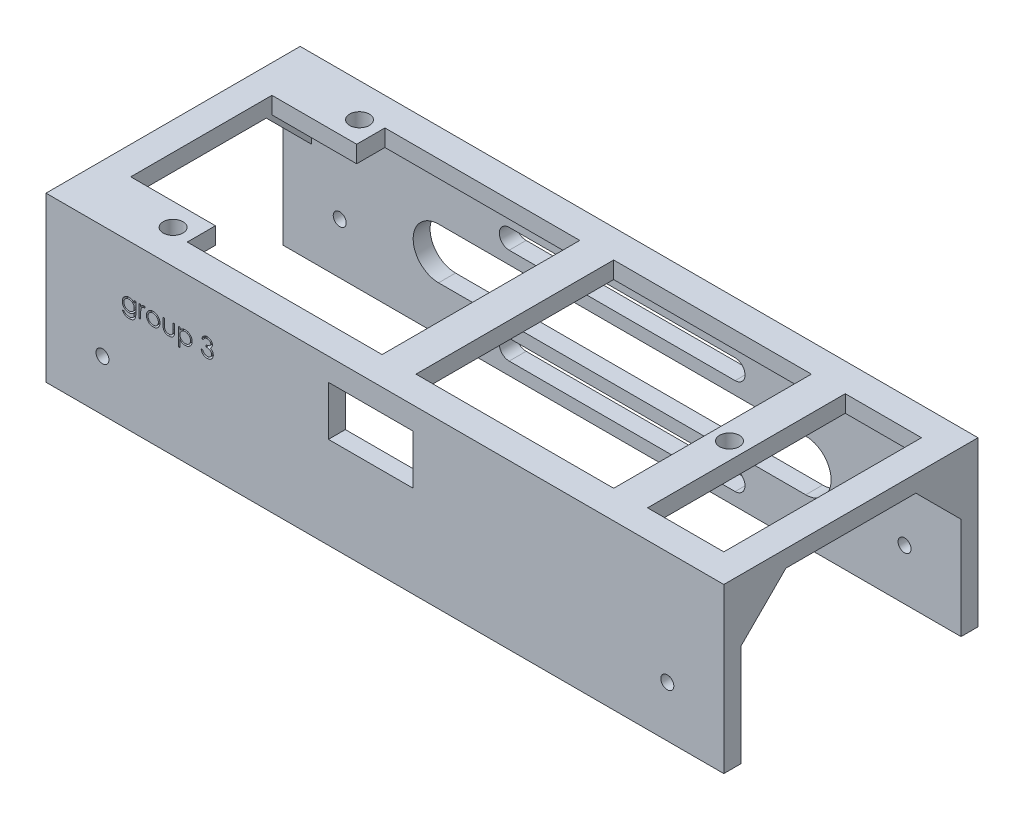
from build123d import *

# Parameters (mm, degrees)
SKETCH1_W           = 120
SKETCH1_H           = 29
BOSS_EXTRUDE5_DEPTH = 45
SHELL9_T            = -3
SKETCH3_R           = 1.15
CUT_EXTRUDE2_DEPTH  = 79
CUT_EXTRUDE8_DEPTH  = 23
SKETCH7_W           = 15
SKETCH7_H           = 8.75
CUT_EXTRUDE9_DEPTH  = 20
SKETCH13_W          = 110
SKETCH13_H          = 35
CUT_EXTRUDE14_DEPTH = 10
SKETCH17_W          = 15
SKETCH17_H          = 5
SKETCH17_W_2        = 6
SKETCH17_H_2        = 35
BOSS_EXTRUDE6_DEPTH = 3
SKETCH17_4_R        = 1.75
CUT_EXTRUDE16_DEPTH = 10
CUT_EXTRUDE15_DEPTH = 1.5
BOSS_EXTRUDE7_DEPTH = 5
BOSS_EXTRUDE8_DEPTH = 5


with BuildPart() as part:
    # Sketch1 → Boss-Extrude5 (new body)
    with BuildSketch(Plane.XY):
        with Locations((60, 14.5)):
            Rectangle(SKETCH1_W, SKETCH1_H)
    extrude(amount=BOSS_EXTRUDE5_DEPTH)

    # Shell9
    shell9_openings = [part.faces().sort_by_distance(p)[0] for p in [
        (120, 14.5, 22.5),
        (60, 0, 22.5),
        (0, 14.5, 22.5),
    ]]
    offset(amount=SHELL9_T, openings=shell9_openings, kind=Kind.INTERSECTION)

    # Sketch3 → Cut-Extrude2 (cut)
    with BuildSketch(Plane(origin=(0, 0, 0), x_dir=(-1, 0, 0), z_dir=(0, 0, -1))):
        with Locations((-10, 9)):
            Circle(SKETCH3_R)
        with Locations((-110, 9)):
            Circle(SKETCH3_R)
    extrude(amount=-CUT_EXTRUDE2_DEPTH, mode=Mode.SUBTRACT)

    # Sketch6 → Cut-Extrude8 (cut)
    with BuildSketch(Plane(origin=(0, 0, 0), x_dir=(-1, 0, 0), z_dir=(0, 0, -1))):
        with BuildLine():
            Line((-40, 22.75), (-80, 22.75))
            ThreePointArc((-80, 22.75), (-81.75, 21), (-80, 19.25))
            Line((-80, 19.25), (-40, 19.25))
            ThreePointArc((-40, 19.25), (-38.25, 21), (-40, 22.75))
        make_face()
        with BuildLine():
            Line((-27.5, 17), (-92.5, 17))
            ThreePointArc((-92.5, 17), (-97, 12.5), (-92.5, 8))
            Line((-92.5, 8), (-27.5, 8))
            ThreePointArc((-27.5, 8), (-23, 12.5), (-27.5, 17))
        make_face()
        with BuildLine():
            ThreePointArc((-80, 5.75), (-81.75, 4), (-80, 2.25))
            Line((-80, 2.25), (-40, 2.25))
            ThreePointArc((-40, 2.25), (-38.25, 4), (-40, 5.75))
            Line((-40, 5.75), (-80, 5.75))
        make_face()
    extrude(amount=-CUT_EXTRUDE8_DEPTH, mode=Mode.SUBTRACT)

    # Sketch7 → Cut-Extrude9 (cut)
    with BuildSketch(Plane.XY.offset(45)):
        with Locations((57.5, 20.625)):
            Rectangle(SKETCH7_W, SKETCH7_H)
    extrude(amount=-CUT_EXTRUDE9_DEPTH, mode=Mode.SUBTRACT)

    # Sketch13 → Cut-Extrude14 (cut)
    with BuildSketch(Plane(origin=(0, 29, 0), x_dir=(1, 0, 0), z_dir=(0, 1, 0))):
        with Locations((60, -22.5)):
            Rectangle(SKETCH13_W, SKETCH13_H)
    extrude(amount=-CUT_EXTRUDE14_DEPTH, mode=Mode.SUBTRACT)

    # Sketch17 → Boss-Extrude6 (add)
    with BuildSketch(Plane(origin=(0, 29, 0), x_dir=(1, 0, 0), z_dir=(0, 1, 0))):
        with Locations((12.5, -7.5)):
            Rectangle(SKETCH17_W, SKETCH17_H)
        with Locations((12.5, -37.5)):
            Rectangle(SKETCH17_W, SKETCH17_H)
        with Locations((57.5, -22.5)):
            Rectangle(SKETCH17_W_2, SKETCH17_H_2)
        with Locations((98.5, -22.5)):
            Rectangle(SKETCH17_W_2, SKETCH17_H_2)
    extrude(amount=-BOSS_EXTRUDE6_DEPTH)

    # Sketch17<4> → Cut-Extrude16 (cut)
    with BuildSketch(Plane(origin=(0, 29, 0), x_dir=(1, 0, 0), z_dir=(0, 1, 0))):
        with Locations((98.5, -22.5)):
            Circle(SKETCH17_4_R)
        with Locations((16.5, -6)):
            Circle(SKETCH17_4_R)
        with Locations((16.5, -39)):
            Circle(SKETCH17_4_R)
    extrude(amount=-CUT_EXTRUDE16_DEPTH, mode=Mode.SUBTRACT)

    # Sketch20 → Cut-Extrude15 (cut)
    # profile 1 of 6: a face of its own
    with BuildSketch(Plane.XY.offset(45)):
        with BuildLine():
            Line((15.616704574, 20.332761713), (15.901640472, 20.332761713))
            Line((15.901640472, 20.332761713), (15.901640472, 18.49149068))
            add(Edge.make_bspline(
                [(15.901640472, 18.49149068), (15.901389155, 18.452268005), (15.900904052, 18.376558794), (15.897410671, 18.267086354), (15.890044057, 18.165970691), (15.881690467, 18.072750642), (15.869673803, 17.9878583), (15.854999527, 17.91104035), (15.838457161, 17.842223075), (15.823924535, 17.799836969), (15.817050127, 17.779786954)],
                knots=[0, 0, 0, 0, 1.307562039, 2.523909702, 3.650326591, 4.686913197, 5.643429486, 6.506965704, 7.293745905, 8, 8, 8, 8], degree=3))
            add(Edge.make_bspline(
                [(15.817050127, 17.779786954), (15.806899889, 17.753724811), (15.786902899, 17.702379766), (15.749450931, 17.629595775), (15.707510176, 17.561064407), (15.659606909, 17.497167576), (15.605957751, 17.438226048), (15.547826683, 17.382959277), (15.484081581, 17.332536497), (15.414758892, 17.287827692), (15.341456639, 17.247562292), (15.264216961, 17.212685764), (15.183475406, 17.182308413), (15.098473497, 17.159554734), (15.010543928, 17.139838237), (14.918652687, 17.127006986), (14.823336649, 17.118273869), (14.758525483, 17.117466301), (14.725643877, 17.117056585)],
                knots=[0, 0, 0, 0, 0.981931301, 1.934503488, 2.87077864, 3.801706999, 4.735015492, 5.667491629, 6.616593066, 7.585388521, 8.561939025, 9.551802639, 10.560317337, 11.588439944, 12.640189604, 13.723962949, 14.845264515, 16, 16, 16, 16], degree=3))
            add(Edge.make_bspline(
                [(14.725643877, 17.117056585), (14.677669868, 17.11783354), (14.583963739, 17.119351142), (14.447343495, 17.137032186), (14.317590571, 17.162027939), (14.196419457, 17.19986072), (14.084595869, 17.246158561), (13.982883496, 17.299312554), (13.89219542, 17.360262855), (13.810440374, 17.429659829), (13.736651931, 17.512176883), (13.667230747, 17.609421549), (13.600409749, 17.722875084), (13.561249628, 17.806144188), (13.540743036, 17.849748893)],
                knots=[0, 0, 0, 0, 1.157897085, 2.2616841, 3.32207898, 4.345638746, 5.321241055, 6.241986252, 7.112515963, 7.955008012, 8.825025602, 9.77857164, 10.836726669, 12, 12, 12, 12], degree=3))
            Line((13.540743036, 17.849748893), (13.825678933, 17.849748893))
            add(Edge.make_bspline(
                [(13.825678933, 17.849748893), (13.848595366, 17.813367134), (13.89339417, 17.742245276), (13.977167435, 17.650158342), (14.068976031, 17.571460647), (14.171918315, 17.508041587), (14.286422618, 17.460226276), (14.412557826, 17.426140115), (14.55135034, 17.405732787), (14.647977577, 17.403273256), (14.698295119, 17.401992483)],
                knots=[0, 0, 0, 0, 0.997731894, 1.950442991, 2.880492273, 3.800895997, 4.748200782, 5.754801363, 6.83083817, 8, 8, 8, 8], degree=3))
            add(Edge.make_bspline(
                [(14.698295119, 17.401992483), (14.747976513, 17.403289832), (14.843757266, 17.405790991), (14.981489827, 17.426149222), (15.107215235, 17.460233694), (15.220209131, 17.507957016), (15.319138293, 17.566422742), (15.404420599, 17.631737095), (15.473494698, 17.705379862), (15.519952175, 17.773217644), (15.548830721, 17.833655247), (15.567220536, 17.885682245), (15.582164779, 17.944513069), (15.594665061, 18.009950487), (15.604980103, 18.08208799), (15.611514147, 18.161090521), (15.616236561, 18.246778529), (15.616544963, 18.306190162), (15.616704574, 18.336938396)],
                knots=[0, 0, 0, 0, 1.570740765, 3.028230971, 4.391408896, 5.680370741, 6.894727393, 8.017376726, 9.065722033, 10.075533815, 10.603371122, 11.180248986, 11.817768598, 12.521299649, 13.286540596, 14.121245857, 15.027658897, 16, 16, 16, 16], degree=3))
            Line((15.616704574, 18.336938396), (15.616704574, 18.457145728))
            add(Edge.make_bspline(
                [(15.616704574, 18.457145728), (15.587783846, 18.422727093), (15.530451097, 18.354495237), (15.431438879, 18.265085752), (15.323292106, 18.188081905), (15.206194892, 18.124927858), (15.083015558, 18.074416852), (14.955088249, 18.039090023), (14.823559742, 18.016266399), (14.734431006, 18.013810477), (14.689390872, 18.012569406)],
                knots=[0, 0, 0, 0, 1.012485704, 2.007162095, 2.997754123, 3.998611389, 4.999708251, 5.992315798, 6.98544096, 8, 8, 8, 8], degree=3))
            add(Edge.make_bspline(
                [(14.689390872, 18.012569406), (14.662869399, 18.013036608), (14.610140308, 18.013965485), (14.531804216, 18.022092376), (14.454624104, 18.033884092), (14.378779973, 18.051193683), (14.304162381, 18.073411178), (14.230894637, 18.101184934), (14.158383509, 18.132585791), (14.087947043, 18.169572548), (14.020286767, 18.210722641), (13.955913021, 18.255298635), (13.895162989, 18.303067225), (13.838614888, 18.354499449), (13.786342893, 18.409520868), (13.737643956, 18.467544948), (13.693323362, 18.52938192), (13.652471645, 18.593904232), (13.617040867, 18.661541641), (13.585940044, 18.730827485), (13.558898655, 18.801613615), (13.537340041, 18.874137022), (13.520874388, 18.948351984), (13.508618682, 19.02413692), (13.501667308, 19.1017252), (13.500583341, 19.153995995), (13.500037908, 19.180297771)],
                knots=[0, 0, 0, 0, 1.028754217, 2.045334182, 3.052854819, 4.056607503, 5.061168794, 6.071104265, 7.095078842, 8.125279047, 9.155117945, 10.165957491, 11.161587969, 12.151493252, 13.128948131, 14.104219989, 15.088194871, 16.07871515, 17.064853787, 18.047899887, 19.02414258, 20.002704429, 20.980574569, 21.971845993, 22.979467364, 24, 24, 24, 24], degree=3))
            add(Edge.make_bspline(
                [(13.500037908, 19.180297771), (13.500508866, 19.206607723), (13.501448958, 19.259125723), (13.509568775, 19.337030594), (13.521151346, 19.413892296), (13.53948268, 19.488918582), (13.561546682, 19.562963892), (13.588873066, 19.635481306), (13.621728655, 19.706492911), (13.658930356, 19.776051293), (13.700735212, 19.843223058), (13.746575391, 19.907019373), (13.796506234, 19.966970786), (13.8498389, 20.023682111), (13.907224591, 20.07660618), (13.96863362, 20.125614541), (14.033460661, 20.171528693), (14.101906631, 20.213358264), (14.172915405, 20.250353587), (14.24468294, 20.284110729), (14.31815991, 20.310902394), (14.391976428, 20.334509063), (14.467432493, 20.351232418), (14.543602915, 20.364134024), (14.620748464, 20.371994163), (14.672412876, 20.372975315), (14.698295119, 20.373466842)],
                knots=[0, 0, 0, 0, 1.008818848, 2.013730394, 3.001654427, 3.987803273, 4.973046549, 5.963777569, 6.957074694, 7.972068341, 8.987420212, 9.989399531, 10.982630087, 11.977756091, 12.973280677, 13.973972381, 14.989194003, 16.018387222, 17.047741039, 18.059210846, 19.057554164, 20.045176975, 21.029480261, 22.018708529, 23.007435371, 24, 24, 24, 24], degree=3))
            add(Edge.make_bspline(
                [(14.698295119, 20.373466842), (14.740977042, 20.372236145), (14.825260726, 20.369805898), (14.949295278, 20.350736716), (15.068985739, 20.320334718), (15.18500751, 20.276777682), (15.298305708, 20.217314433), (15.408506924, 20.138989044), (15.515929996, 20.04109895), (15.582222028, 19.966030281), (15.616704574, 19.926982467)],
                knots=[0, 0, 0, 0, 0.96728863, 1.910097829, 2.838038873, 3.762875196, 4.71315279, 5.730631239, 6.819562287, 8, 8, 8, 8], degree=3))
            Line((15.616704574, 19.926982467), (15.616704574, 20.332761713))
        make_face()
        with BuildLine():
            add(Edge.make_bspline(
                [(14.721191754, 20.088530944), (14.679526044, 20.087114835), (14.597036773, 20.084311238), (14.476125205, 20.060376534), (14.359396844, 20.022869897), (14.249083349, 19.969219095), (14.145753328, 19.903819322), (14.054064026, 19.824589204), (13.973868138, 19.734105154), (13.90602933, 19.633185287), (13.852025876, 19.524307938), (13.813795774, 19.409544629), (13.78907611, 19.290749742), (13.78634774, 19.209676024), (13.784973805, 19.168849454)],
                knots=[0, 0, 0, 0, 1.026226791, 2.031711442, 3.026614839, 4.04107745, 5.047145931, 6.032893242, 7.017642609, 8.019221815, 9.021877557, 10.003543541, 10.994637589, 12, 12, 12, 12], degree=3))
            add(Edge.make_bspline(
                [(13.784973805, 19.168849454), (13.78563217, 19.138067128), (13.786926982, 19.077527295), (13.799376227, 18.988683633), (13.819497532, 18.904065063), (13.848015569, 18.823666466), (13.883351228, 18.747026688), (13.927794307, 18.674673668), (13.980091974, 18.60654297), (14.039834895, 18.543138509), (14.105672041, 18.485388916), (14.177081601, 18.434645122), (14.25396672, 18.393142682), (14.334436469, 18.357273494), (14.42044337, 18.331076054), (14.510748612, 18.311083733), (14.605991079, 18.299645788), (14.670916871, 18.298228108), (14.704019278, 18.297505303)],
                knots=[0, 0, 0, 0, 1.039728707, 2.044842319, 3.024901384, 3.974314358, 4.923051295, 5.871625912, 6.837440708, 7.820715446, 8.810779094, 9.792721783, 10.773906224, 11.758876063, 12.764959493, 13.806266761, 14.881525401, 16, 16, 16, 16], degree=3))
            add(Edge.make_bspline(
                [(14.704019278, 18.297505303), (14.737550687, 18.298201634), (14.803121003, 18.299563302), (14.898888923, 18.311268619), (14.989632909, 18.330157126), (15.075269755, 18.356975013), (15.1561228, 18.39119403), (15.231283772, 18.434497961), (15.302364264, 18.483814268), (15.367094722, 18.541338023), (15.425627358, 18.604733697), (15.476636696, 18.673717281), (15.520101946, 18.747250752), (15.556095261, 18.825325821), (15.583573711, 18.908549241), (15.60200586, 18.996712964), (15.614893407, 19.089394606), (15.616091675, 19.152902422), (15.616704574, 19.185385912)],
                knots=[0, 0, 0, 0, 1.121943988, 2.193949579, 3.223793937, 4.220241907, 5.192961521, 6.155822191, 7.11847367, 8.083710714, 9.04790392, 10.001595906, 10.949595423, 11.902125208, 12.873731292, 13.87582262, 14.913508608, 16, 16, 16, 16], degree=3))
            add(Edge.make_bspline(
                [(15.616704574, 19.185385912), (15.615489395, 19.227674965), (15.613115361, 19.310292915), (15.59071151, 19.430676912), (15.554588891, 19.543859923), (15.503927909, 19.649483987), (15.440444229, 19.746429935), (15.363980388, 19.83290228), (15.27585506, 19.909012343), (15.176321441, 19.97241999), (15.069235544, 20.023642205), (14.957184173, 20.062070384), (14.840333683, 20.083836656), (14.761134297, 20.086957176), (14.721191754, 20.088530944)],
                knots=[0, 0, 0, 0, 1.070913519, 2.092188694, 3.091357305, 4.074328408, 5.051968682, 6.018948707, 6.99050112, 7.9935919, 9.000589572, 9.992915277, 10.987769056, 12, 12, 12, 12], degree=3))
        make_face(mode=Mode.SUBTRACT)
    # profile 2 of 6: a face of its own
    with BuildSketch(Plane.XY.offset(45)):
        with BuildLine():
            Line((16.471512267, 20.332761713), (16.756448164, 20.332761713))
            Line((16.756448164, 20.332761713), (16.756448164, 19.991220247))
            add(Edge.make_bspline(
                [(16.756448164, 19.991220247), (16.777483681, 20.023020891), (16.817713944, 20.083839376), (16.884582101, 20.1642751), (16.953074409, 20.230873035), (17.023518757, 20.283944084), (17.096433176, 20.323688842), (17.170217411, 20.352801809), (17.246032302, 20.370016945), (17.29697919, 20.372315336), (17.322503853, 20.373466842)],
                knots=[0, 0, 0, 0, 1.2804753, 2.448899062, 3.506932113, 4.484331642, 5.4025378, 6.288909075, 7.142734305, 8, 8, 8, 8], degree=3))
            add(Edge.make_bspline(
                [(17.322503853, 20.373466842), (17.342303449, 20.372386864), (17.383042405, 20.37016474), (17.444712326, 20.354552063), (17.508251743, 20.329625571), (17.549202337, 20.306184798), (17.570550728, 20.293964638)],
                knots=[0, 0, 0, 0, 0.901110191, 1.854092781, 2.881294221, 4, 4, 4, 4], degree=3))
            Line((17.570550728, 20.293964638), (17.414090392, 20.047189798))
            add(Edge.make_bspline(
                [(17.414090392, 20.047189798), (17.400384351, 20.053304183), (17.374367662, 20.064910455), (17.336308877, 20.078646421), (17.301219379, 20.08673443), (17.278864151, 20.087959724), (17.268442355, 20.088530944)],
                knots=[0, 0, 0, 0, 1.180555205, 2.24091978, 3.179933427, 4, 4, 4, 4], degree=3))
            add(Edge.make_bspline(
                [(17.268442355, 20.088530944), (17.245577154, 20.08700691), (17.198938771, 20.083898323), (17.130463547, 20.059460976), (17.064017868, 20.019977365), (17.01124786, 19.976188571), (16.970388102, 19.933963069), (16.941232326, 19.897089161), (16.914487262, 19.855742831), (16.888932848, 19.810630903), (16.865649853, 19.760983115), (16.843919546, 19.707295485), (16.824271863, 19.649505833), (16.813068427, 19.609244546), (16.807329574, 19.588621088)],
                knots=[0, 0, 0, 0, 1.125678352, 2.296057538, 3.5422874, 4.923748041, 5.663163013, 6.437101912, 7.23742474, 8.08941207, 8.991984279, 9.93940061, 10.944477711, 12, 12, 12, 12], degree=3))
            add(Edge.make_bspline(
                [(16.807329574, 19.588621088), (16.803036618, 19.570226795), (16.793528044, 19.529484834), (16.784282864, 19.461132958), (16.775148372, 19.380375782), (16.768710726, 19.286988515), (16.762743502, 19.18120437), (16.759377927, 19.06286219), (16.756562935, 18.931840507), (16.756487582, 18.840242344), (16.756448164, 18.792327018)],
                knots=[0, 0, 0, 0, 0.566838948, 1.255505196, 2.06880316, 3.007127437, 4.065329342, 5.249902469, 6.561414163, 8, 8, 8, 8], degree=3))
            Line((16.756448164, 18.792327018), (16.756448164, 18.012569406))
            Line((16.756448164, 18.012569406), (16.471512267, 18.012569406))
            Line((16.471512267, 18.012569406), (16.471512267, 20.332761713))
        make_face()
    # profile 3 of 6: a face of its own
    with BuildSketch(Plane.XY.offset(45)):
        with BuildLine():
            add(Edge.make_bspline(
                [(18.976149687, 20.373466842), (19.019684627, 20.37253984), (19.105046006, 20.370722218), (19.230057445, 20.351295784), (19.349387675, 20.321589247), (19.463493721, 20.280521473), (19.570914218, 20.225474275), (19.673213846, 20.159788703), (19.770112133, 20.081971636), (19.828190167, 20.021775389), (19.857670119, 19.991220247)],
                knots=[0, 0, 0, 0, 1.054011418, 2.066658804, 3.057071809, 4.030435133, 4.997543892, 5.974964718, 6.972108034, 8, 8, 8, 8], degree=3))
            add(Edge.make_bspline(
                [(19.857670119, 19.991220247), (19.883053749, 19.96199756), (19.933329765, 19.904117725), (19.997796525, 19.810268705), (20.053333226, 19.713077328), (20.09784034, 19.611252967), (20.132933183, 19.505684516), (20.157848493, 19.39600912), (20.172668427, 19.282468991), (20.174666833, 19.205358366), (20.175678933, 19.166305383)],
                knots=[0, 0, 0, 0, 1.025258237, 2.030674902, 3.01204498, 3.988269485, 4.97094183, 5.956517959, 6.965070386, 8, 8, 8, 8], degree=3))
            add(Edge.make_bspline(
                [(20.175678933, 19.166305383), (20.17478872, 19.127026045), (20.173029618, 19.049408242), (20.156389337, 18.935090674), (20.130507566, 18.824242513), (20.093467256, 18.717327841), (20.045970971, 18.614019848), (19.98801299, 18.514769757), (19.919186595, 18.41938175), (19.841168683, 18.328665797), (19.754943053, 18.245057873), (19.661401975, 18.172188657), (19.562383673, 18.109757703), (19.456571489, 18.059468955), (19.344931697, 18.019818012), (19.227223499, 17.991968712), (19.103629757, 17.975130613), (19.019240778, 17.972968371), (18.976149687, 17.971864278)],
                knots=[0, 0, 0, 0, 0.998656419, 1.973391657, 2.932242238, 3.890759089, 4.846373663, 5.82037756, 6.809684879, 7.83454468, 8.860553229, 9.859544525, 10.845671541, 11.83227036, 12.833544569, 13.85385346, 14.904124723, 16, 16, 16, 16], degree=3))
            add(Edge.make_bspline(
                [(18.976149687, 17.971864278), (18.932847477, 17.972972077), (18.848037911, 17.975141758), (18.724007913, 17.991903293), (18.606088759, 18.019805177), (18.494302816, 18.05959926), (18.388035705, 18.10975931), (18.288443668, 18.171999915), (18.194826602, 18.245079484), (18.10858273, 18.328659941), (18.03056971, 18.419383259), (17.961742052, 18.514769365), (17.903784399, 18.61401995), (17.856288029, 18.717327814), (17.819247741, 18.824242521), (17.793365964, 18.935090672), (17.776725685, 19.049408242), (17.774966583, 19.127026045), (17.774076369, 19.166305383)],
                knots=[0, 0, 0, 0, 1.099876186, 2.154163076, 3.173186993, 4.173200201, 5.163417411, 6.152872554, 7.150605724, 8.17532212, 9.198891216, 10.186952605, 11.159729845, 12.11414092, 13.071450619, 14.029093627, 15.002601286, 16, 16, 16, 16], degree=3))
            add(Edge.make_bspline(
                [(17.774076369, 19.166305383), (17.775095372, 19.205146107), (17.777112823, 19.282044065), (17.791917856, 19.395370756), (17.816735975, 19.50486053), (17.851870885, 19.610021498), (17.896788237, 19.711399643), (17.951544548, 19.808831168), (18.016668907, 19.902255816), (18.066744963, 19.960060846), (18.092085183, 19.989312194)],
                knots=[0, 0, 0, 0, 1.031353054, 2.041901799, 3.029428768, 4.008703097, 4.981709435, 5.96992636, 6.972712378, 8, 8, 8, 8], degree=3))
            add(Edge.make_bspline(
                [(18.092085183, 19.989312194), (18.121520691, 20.020132318), (18.179410796, 20.080745514), (18.276791428, 20.158335732), (18.378839394, 20.22538817), (18.487447005, 20.279341594), (18.601459312, 20.321830821), (18.721401054, 20.351372396), (18.8468367, 20.370652225), (18.932615785, 20.372519286), (18.976149687, 20.373466842)],
                knots=[0, 0, 0, 0, 1.027980169, 2.021703884, 2.998553061, 3.971491411, 4.943284454, 5.930300938, 6.949603206, 8, 8, 8, 8], degree=3))
        make_face()
        with BuildLine():
            add(Edge.make_bspline(
                [(18.974877651, 20.088530944), (18.94409139, 20.087655922), (18.883313609, 20.085928465), (18.793851557, 20.072789495), (18.707727274, 20.05197283), (18.624777366, 20.022396294), (18.545281559, 19.984206578), (18.469163744, 19.937299709), (18.396200031, 19.882296955), (18.327817731, 19.819284389), (18.26505949, 19.750451301), (18.210197326, 19.67711029), (18.163547408, 19.600450961), (18.124685264, 19.520393598), (18.095740886, 19.436126908), (18.074719644, 19.348605193), (18.061593069, 19.257650137), (18.059881854, 19.195818356), (18.059012267, 19.16439733)],
                knots=[0, 0, 0, 0, 1.021534396, 2.016698045, 2.994645724, 3.958388632, 4.93408049, 5.916473867, 6.921342795, 7.962252576, 8.998418191, 10.008913653, 10.997312074, 11.973003931, 12.956656626, 13.948281152, 14.957379055, 16, 16, 16, 16], degree=3))
            add(Edge.make_bspline(
                [(18.059012267, 19.16439733), (18.060469885, 19.123800849), (18.063362986, 19.043224424), (18.08688995, 18.924560048), (18.126247504, 18.810639368), (18.179394536, 18.702130218), (18.245984463, 18.601734651), (18.324440588, 18.512225519), (18.413920888, 18.434949819), (18.513358713, 18.370832194), (18.620722987, 18.319887273), (18.734348364, 18.283783917), (18.852858136, 18.260314596), (18.933848514, 18.257981901), (18.974877651, 18.256800175)],
                knots=[0, 0, 0, 0, 1.016792936, 2.018143844, 3.017858371, 4.030088057, 5.03801393, 6.028138512, 7.003788237, 7.991172063, 8.984598303, 9.972568034, 10.972917682, 12, 12, 12, 12], degree=3))
            add(Edge.make_bspline(
                [(18.974877651, 18.256800175), (19.015904429, 18.257988786), (19.096890148, 18.260335072), (19.215235258, 18.283665716), (19.328550076, 18.320045465), (19.435802834, 18.370774898), (19.535195396, 18.435193303), (19.625319242, 18.51178916), (19.703105482, 18.601971725), (19.769629538, 18.702263197), (19.82364694, 18.810471145), (19.862820273, 18.924581074), (19.886403798, 19.043219069), (19.889289264, 19.123799055), (19.890743036, 19.16439733)],
                knots=[0, 0, 0, 0, 1.02726834, 2.027799167, 3.010890988, 4.004497153, 4.992059811, 5.971914811, 6.958719428, 7.966827853, 8.981595046, 9.981490638, 10.983022906, 12, 12, 12, 12], degree=3))
            add(Edge.make_bspline(
                [(19.890743036, 19.16439733), (19.889873748, 19.195818544), (19.888163122, 19.257650694), (19.875032262, 19.348603063), (19.854026879, 19.436134725), (19.825024055, 19.520364757), (19.786330771, 19.600658243), (19.738781252, 19.67688521), (19.684143107, 19.750705362), (19.620627576, 19.819061879), (19.552316655, 19.882321519), (19.47932337, 19.937321037), (19.403318425, 19.984000427), (19.324053568, 20.022722945), (19.241093025, 20.051703747), (19.155089415, 20.072909691), (19.066009066, 20.085872941), (19.005449077, 20.087639276), (18.974877651, 20.088530944)],
                knots=[0, 0, 0, 0, 1.042956736, 2.052379634, 3.044323526, 4.02829302, 5.004299113, 5.996692471, 7.007513377, 8.048758398, 9.090003419, 10.095195979, 11.07790575, 12.047570684, 13.018257071, 13.989683339, 14.985167495, 16, 16, 16, 16], degree=3))
        make_face(mode=Mode.SUBTRACT)
    # profile 4 of 6: a face of its own
    with BuildSketch(Plane.XY.offset(45)):
        with BuildLine():
            Line((20.7048456, 20.332761713), (20.989781497, 20.332761713))
            Line((20.989781497, 20.332761713), (20.989781497, 19.256619887))
            add(Edge.make_bspline(
                [(20.989781497, 19.256619887), (20.989910225, 19.225030678), (20.990156476, 19.164602003), (20.991826473, 19.077647655), (20.995754486, 18.998348208), (21.000665598, 18.926657854), (21.00698125, 18.86258872), (21.014495442, 18.806364589), (21.022894153, 18.757347865), (21.031115329, 18.727826393), (21.034938749, 18.71409685)],
                knots=[0, 0, 0, 0, 1.388932606, 2.656963016, 3.823490214, 4.879454478, 5.816252168, 6.653371382, 7.373723809, 8, 8, 8, 8], degree=3))
            add(Edge.make_bspline(
                [(21.034938749, 18.71409685), (21.041072355, 18.696840388), (21.05321205, 18.662686223), (21.075231567, 18.613347625), (21.102471558, 18.567650048), (21.132280116, 18.523831353), (21.166660293, 18.483189551), (21.205177099, 18.445793272), (21.246541214, 18.410229561), (21.3080047, 18.368151928), (21.392059891, 18.323053022), (21.502416319, 18.284140387), (21.622072295, 18.260885035), (21.704771719, 18.258186961), (21.747278493, 18.256800175)],
                knots=[0, 0, 0, 0, 0.725840625, 1.436591201, 2.137033971, 2.831655856, 3.53531722, 4.242432219, 4.957935707, 5.694543706, 7.190802206, 8.724350549, 10.316345118, 12, 12, 12, 12], degree=3))
            add(Edge.make_bspline(
                [(21.747278493, 18.256800175), (21.789781318, 18.258216451), (21.872016419, 18.260956682), (21.990357713, 18.283438892), (22.098535782, 18.320999767), (22.195464859, 18.373439347), (22.2807053, 18.437612504), (22.351738594, 18.512913352), (22.410346603, 18.596959582), (22.435936578, 18.659665178), (22.448805937, 18.691200215)],
                knots=[0, 0, 0, 0, 1.157059328, 2.238695713, 3.266970494, 4.264342957, 5.228770407, 6.160125903, 7.074715775, 8, 8, 8, 8], degree=3))
            add(Edge.make_bspline(
                [(22.448805937, 18.691200215), (22.452610702, 18.703869643), (22.46102211, 18.731878654), (22.470059386, 18.779394569), (22.478200505, 18.836058889), (22.485152101, 18.902242407), (22.490109784, 18.977772166), (22.492782251, 19.062624564), (22.495801472, 19.156533227), (22.495847297, 19.222271837), (22.495871241, 19.256619887)],
                knots=[0, 0, 0, 0, 0.557542046, 1.232589297, 2.036731608, 2.971723315, 4.038036528, 5.22795436, 6.551621927, 8, 8, 8, 8], degree=3))
            Line((22.495871241, 19.256619887), (22.495871241, 20.332761713))
            Line((22.495871241, 20.332761713), (22.780807138, 20.332761713))
            Line((22.780807138, 20.332761713), (22.780807138, 19.203194406))
            add(Edge.make_bspline(
                [(22.780807138, 19.203194406), (22.780406458, 19.164815757), (22.779629084, 19.09035593), (22.774633136, 18.9821482), (22.766060988, 18.881308163), (22.753050123, 18.787782443), (22.737750547, 18.701642441), (22.7180145, 18.622777758), (22.694448527, 18.551431377), (22.667864238, 18.486351337), (22.636457258, 18.427344511), (22.60304989, 18.371341306), (22.564473847, 18.319731286), (22.523860848, 18.269945348), (22.478683632, 18.224459819), (22.42978876, 18.18223098), (22.377864429, 18.142613302), (22.321758371, 18.107151927), (22.262289657, 18.075205398), (22.199384872, 18.046887956), (22.132273538, 18.02447919), (22.061821525, 18.005147372), (21.98768366, 17.98998496), (21.909931418, 17.97929286), (21.828590988, 17.972738453), (21.773155978, 17.972160562), (21.744734422, 17.971864278)],
                knots=[0, 0, 0, 0, 1.493040784, 2.896703357, 4.213163133, 5.428574705, 6.569057535, 7.615249723, 8.588095153, 9.490268104, 10.346124644, 11.18633936, 12.024365274, 12.850166724, 13.684164916, 14.514361689, 15.362232829, 16.222528818, 17.093394965, 17.986930858, 18.902426812, 19.842810585, 20.827885679, 21.843828298, 22.894529745, 24, 24, 24, 24], degree=3))
            add(Edge.make_bspline(
                [(21.744734422, 17.971864278), (21.716525441, 17.97217244), (21.661092168, 17.972778009), (21.57974754, 17.979256649), (21.501779875, 17.989968347), (21.427466371, 18.005258437), (21.356732454, 18.024343879), (21.289291607, 18.047025657), (21.225933518, 18.075220094), (21.165896986, 18.106949736), (21.109651962, 18.142841093), (21.056939181, 18.1821821), (21.007829322, 18.224914029), (20.962311553, 18.270858417), (20.921024781, 18.320585209), (20.883454515, 18.373694396), (20.849022361, 18.429659748), (20.817859472, 18.489588474), (20.791088094, 18.555421654), (20.767452264, 18.628262592), (20.748120471, 18.708909875), (20.732388374, 18.797294553), (20.719732425, 18.892993627), (20.71094571, 18.996560689), (20.706032778, 19.107743467), (20.705249858, 19.18453301), (20.7048456, 19.224182988)],
                knots=[0, 0, 0, 0, 1.083640291, 2.129454052, 3.13281866, 4.105697902, 5.042300162, 5.946461698, 6.836384745, 7.703652036, 8.553297018, 9.397182691, 10.228592656, 11.052265423, 11.879314572, 12.708807002, 13.549817954, 14.402308542, 15.300838682, 16.27712199, 17.341985831, 18.484375296, 19.725102775, 21.0496083, 22.476576903, 24, 24, 24, 24], degree=3))
            Line((20.7048456, 19.224182988), (20.7048456, 20.332761713))
        make_face()
    # profile 5 of 6: a face of its own
    with BuildSketch(Plane.XY.offset(45)):
        with BuildLine():
            Line((23.43208919, 20.332761713), (23.717025087, 20.332761713))
            Line((23.717025087, 20.332761713), (23.717025087, 19.903449814))
            add(Edge.make_bspline(
                [(23.717025087, 19.903449814), (23.747285091, 19.942400473), (23.806089351, 20.018093283), (23.907439801, 20.116055757), (24.014416263, 20.198674068), (24.129771645, 20.263428223), (24.251713135, 20.312251388), (24.379740309, 20.348337032), (24.51493976, 20.369601798), (24.607374399, 20.372161448), (24.654515071, 20.373466842)],
                knots=[0, 0, 0, 0, 1.0828784, 2.104357462, 3.088488658, 4.04616522, 5.001424249, 5.969181776, 6.964304535, 8, 8, 8, 8], degree=3))
            add(Edge.make_bspline(
                [(24.654515071, 20.373466842), (24.69569174, 20.372275601), (24.777079588, 20.369921051), (24.896879803, 20.35397978), (25.012246044, 20.32665873), (25.122525636, 20.2872879), (25.228899988, 20.238614724), (25.329794321, 20.177185698), (25.42678019, 20.106060082), (25.517418447, 20.024206631), (25.601167116, 19.935643847), (25.673599009, 19.840373614), (25.736075665, 19.741528982), (25.786576577, 19.637577584), (25.826135578, 19.529337997), (25.854270321, 19.416372911), (25.87101404, 19.299101165), (25.873260536, 19.21936084), (25.874396882, 19.179025736)],
                knots=[0, 0, 0, 0, 1.041296284, 2.058176809, 3.050446431, 4.034000596, 5.01514041, 6.003636468, 7.015969324, 8.052561599, 9.08815499, 10.094063707, 11.074456064, 12.040834395, 13.011057502, 13.983766392, 14.980127149, 16, 16, 16, 16], degree=3))
            add(Edge.make_bspline(
                [(25.874396882, 19.179025736), (25.873285192, 19.137839356), (25.871092778, 19.056613871), (25.854088379, 18.93733629), (25.826913215, 18.822594172), (25.787853292, 18.712578369), (25.737378513, 18.607364628), (25.675960805, 18.507028826), (25.603492367, 18.41160311), (25.520669201, 18.322382979), (25.430814037, 18.240196459), (25.334768029, 18.16831621), (25.234021718, 18.107953677), (25.129090538, 18.057531992), (25.019076209, 18.019529797), (24.904492021, 17.992117935), (24.785400359, 17.975213785), (24.704391457, 17.972989342), (24.663419318, 17.971864278)],
                knots=[0, 0, 0, 0, 1.038740735, 2.04854663, 3.033179607, 4.009277356, 4.987731542, 5.972001279, 6.972200261, 8.005528982, 9.039189865, 10.040446548, 11.026516639, 11.997840187, 12.972163198, 13.956796175, 14.96660207, 16, 16, 16, 16], degree=3))
            add(Edge.make_bspline(
                [(24.663419318, 17.971864278), (24.617311449, 17.973038853), (24.52623489, 17.975358984), (24.393068432, 17.998871592), (24.264910145, 18.034011526), (24.143179897, 18.085445614), (24.026913381, 18.150991689), (23.916768272, 18.230920233), (23.812159503, 18.325064085), (23.749195845, 18.39648509), (23.717025087, 18.432977058)],
                knots=[0, 0, 0, 0, 1.014726462, 2.004382257, 2.969841629, 3.936926163, 4.907207904, 5.903978561, 6.929055279, 8, 8, 8, 8], degree=3))
            Line((23.717025087, 18.432977058), (23.717025087, 17.157761713))
            Line((23.717025087, 17.157761713), (23.43208919, 17.157761713))
            Line((23.43208919, 17.157761713), (23.43208919, 20.332761713))
        make_face()
        with BuildLine():
            add(Edge.make_bspline(
                [(24.651971001, 20.088530944), (24.619695255, 20.087950139), (24.55615263, 20.086806682), (24.46301426, 20.073223171), (24.373301979, 20.053503935), (24.287919923, 20.023648139), (24.206049721, 19.987000645), (24.128321943, 19.941206249), (24.05479115, 19.887093358), (23.985642343, 19.825698524), (23.923173499, 19.758048629), (23.867871414, 19.685851116), (23.821419073, 19.609197418), (23.782863669, 19.528801553), (23.753523691, 19.44403333), (23.732699574, 19.355375526), (23.719609182, 19.262731101), (23.717895646, 19.199633867), (23.717025087, 19.167577419)],
                knots=[0, 0, 0, 0, 1.05670511, 2.080379991, 3.077984906, 4.06214886, 5.038337365, 6.01289324, 7.01187578, 8.025460281, 9.038092164, 10.024533457, 11.000252242, 11.969694649, 12.940728589, 13.933144304, 14.949937299, 16, 16, 16, 16], degree=3))
            add(Edge.make_bspline(
                [(23.717025087, 19.167577419), (23.718468221, 19.125496774), (23.721295442, 19.043057226), (23.744280055, 18.922603059), (23.78168633, 18.808619057), (23.834780234, 18.702065116), (23.901861248, 18.604109258), (23.982686004, 18.516397065), (24.076523176, 18.439479886), (24.181812699, 18.374690606), (24.294681347, 18.322087146), (24.41241571, 18.284427827), (24.533396709, 18.261230162), (24.615192256, 18.258284834), (24.656423124, 18.256800175)],
                knots=[0, 0, 0, 0, 1.03728447, 2.032128127, 3.01272805, 3.987917167, 4.958271349, 5.931593992, 6.91984656, 7.941419022, 8.973179163, 9.983609215, 10.983593296, 12, 12, 12, 12], degree=3))
            add(Edge.make_bspline(
                [(24.656423124, 18.256800175), (24.696823428, 18.258212031), (24.777010768, 18.261014312), (24.895082778, 18.285269668), (25.009827857, 18.32232194), (25.118848442, 18.376350966), (25.221195463, 18.442563376), (25.313616587, 18.521992835), (25.394358573, 18.614058712), (25.463178381, 18.716573568), (25.518633371, 18.826496952), (25.56029866, 18.940235783), (25.584345723, 19.057389131), (25.587753667, 19.136308485), (25.589460985, 19.175845648)],
                knots=[0, 0, 0, 0, 1.00104056, 1.986885549, 2.97790532, 3.984399681, 4.995088187, 5.994304198, 6.996462723, 8.023150851, 9.048424203, 10.043036403, 11.019596776, 12, 12, 12, 12], degree=3))
            add(Edge.make_bspline(
                [(25.589460985, 19.175845648), (25.588141333, 19.215628388), (25.585512312, 19.294883921), (25.55961607, 19.411690268), (25.520699662, 19.525888647), (25.463949665, 19.63431086), (25.396638513, 19.736613063), (25.315225166, 19.826922653), (25.223951902, 19.905998906), (25.121726732, 19.971327171), (25.012016489, 20.023293299), (24.896523672, 20.061287742), (24.775834119, 20.08412393), (24.693621889, 20.087049017), (24.651971001, 20.088530944)],
                knots=[0, 0, 0, 0, 0.983928682, 1.960191568, 2.949917689, 3.96440592, 4.982380491, 5.975291189, 6.965713506, 7.964880129, 8.970154049, 9.96478489, 10.968906225, 12, 12, 12, 12], degree=3))
        make_face(mode=Mode.SUBTRACT)
    # profile 6 of 6: a face of its own
    with BuildSketch(Plane.XY.offset(45)):
        with BuildLine():
            Line((27.868948164, 20.454877098), (27.584012267, 20.454877098))
            add(Edge.make_bspline(
                [(27.584012267, 20.454877098), (27.591731645, 20.486837994), (27.606822398, 20.549318932), (27.638298054, 20.638588376), (27.672587378, 20.723064713), (27.71376178, 20.801166151), (27.758673293, 20.874462299), (27.810128904, 20.941290719), (27.865754653, 21.003351052), (27.927281571, 21.058426632), (27.991805428, 21.108299286), (28.060235405, 21.150821659), (28.131194744, 21.187401427), (28.205175086, 21.217536923), (28.282396685, 21.240238648), (28.362161414, 21.256709464), (28.444678304, 21.267405689), (28.50069219, 21.268449596), (28.529134462, 21.268979662)],
                knots=[0, 0, 0, 0, 1.162005537, 2.271625781, 3.343758855, 4.383309926, 5.390229558, 6.379919256, 7.361854164, 8.333198761, 9.295911338, 10.242430842, 11.177959212, 12.116337295, 13.062827104, 14.020064771, 14.994644689, 16, 16, 16, 16], degree=3))
            add(Edge.make_bspline(
                [(28.529134462, 21.268979662), (28.570575235, 21.267728503), (28.652552838, 21.265253477), (28.772987888, 21.242652524), (28.889126502, 21.206888297), (28.999697463, 21.157472844), (29.102402755, 21.096524353), (29.193784868, 21.023984913), (29.27260516, 20.941254118), (29.338730774, 20.849875292), (29.390505951, 20.752216366), (29.428684304, 20.651704794), (29.451926829, 20.548579006), (29.454939049, 20.478949189), (29.456448164, 20.444064798)],
                knots=[0, 0, 0, 0, 1.083050992, 2.142477498, 3.193116406, 4.255571735, 5.30263384, 6.308962982, 7.297363603, 8.282367274, 9.249857812, 10.179914175, 11.08814088, 12, 12, 12, 12], degree=3))
            add(Edge.make_bspline(
                [(29.456448164, 20.444064798), (29.455392621, 20.410494349), (29.453327086, 20.344802189), (29.435788653, 20.248897688), (29.406273615, 20.158508522), (29.365388902, 20.073254182), (29.312464781, 19.99367522), (29.248354549, 19.919592591), (29.172605706, 19.850677711), (29.115202669, 19.811199332), (29.085649887, 19.790874694)],
                knots=[0, 0, 0, 0, 1.024540389, 2.004866551, 2.965041327, 3.920577974, 4.882998113, 5.874504559, 6.905732034, 8, 8, 8, 8], degree=3))
            add(Edge.make_bspline(
                [(29.085649887, 19.790874694), (29.119424407, 19.774565924), (29.1863415, 19.742253534), (29.277555195, 19.678884383), (29.360357267, 19.605717553), (29.406534213, 19.548619575), (29.429735424, 19.519931185)],
                knots=[0, 0, 0, 0, 1.015518401, 2.012035669, 3.001164323, 4, 4, 4, 4], degree=3))
            add(Edge.make_bspline(
                [(29.429735424, 19.519931185), (29.445012927, 19.49901451), (29.475317754, 19.457523686), (29.512724274, 19.390815642), (29.546659685, 19.32336822), (29.573103098, 19.253373616), (29.59358082, 19.181643096), (29.608218507, 19.108053494), (29.617311835, 19.032544717), (29.618614085, 18.981461252), (29.619268677, 18.955783548)],
                knots=[0, 0, 0, 0, 1.025084078, 2.033381695, 3.024893161, 4.013698104, 4.991890475, 5.976764909, 6.982997093, 8, 8, 8, 8], degree=3))
            add(Edge.make_bspline(
                [(29.619268677, 18.955783548), (29.617640797, 18.91132473), (29.614392697, 18.822616317), (29.58536043, 18.691557105), (29.540354133, 18.563445399), (29.476439627, 18.440913224), (29.39854553, 18.326268164), (29.305874243, 18.223691798), (29.199478715, 18.135518778), (29.080819305, 18.0618495), (28.952261624, 18.00295967), (28.814760909, 17.962086133), (28.67029836, 17.935465119), (28.57123174, 17.932610459), (28.520866233, 17.931159149)],
                knots=[0, 0, 0, 0, 0.955779014, 1.907060117, 2.875433937, 3.871313158, 4.872415639, 5.851225146, 6.836215519, 7.83643374, 8.849228613, 9.86973379, 10.916971861, 12, 12, 12, 12], degree=3))
            add(Edge.make_bspline(
                [(28.520866233, 17.931159149), (28.486921582, 17.931946743), (28.420129828, 17.933496464), (28.321937512, 17.944090624), (28.22820997, 17.963439986), (28.138820478, 17.989477984), (28.053689623, 18.022490493), (27.973077185, 18.063601026), (27.89648721, 18.111962174), (27.824642448, 18.168144786), (27.757551461, 18.230992859), (27.696997204, 18.301622104), (27.641970106, 18.378726891), (27.59394357, 18.463202807), (27.550730048, 18.553958147), (27.515187323, 18.652154999), (27.483903986, 18.756915505), (27.469359344, 18.829920312), (27.461896882, 18.867377098)],
                knots=[0, 0, 0, 0, 1.048658725, 2.063410685, 3.046034179, 4.001477787, 4.936774919, 5.862367409, 6.792675028, 7.730719943, 8.675894397, 9.627829632, 10.600096036, 11.597688215, 12.626045268, 13.701542398, 14.82072376, 16, 16, 16, 16], degree=3))
            Line((27.461896882, 18.867377098), (27.74683278, 18.867377098))
            add(Edge.make_bspline(
                [(27.74683278, 18.867377098), (27.754256194, 18.842930493), (27.76869538, 18.795379723), (27.793273779, 18.726944589), (27.821275711, 18.664208355), (27.851315346, 18.606710808), (27.882864365, 18.5538857), (27.918165762, 18.507129862), (27.954604915, 18.464389643), (27.982072614, 18.440309888), (27.995515672, 18.428524935)],
                knots=[0, 0, 0, 0, 1.198163088, 2.33053128, 3.407730985, 4.417276592, 5.372219308, 6.28897303, 7.162600585, 8, 8, 8, 8], degree=3))
            add(Edge.make_bspline(
                [(27.995515672, 18.428524935), (28.013292567, 18.414819517), (28.048791482, 18.387450989), (28.106638378, 18.352524511), (28.16747581, 18.322261295), (28.232621979, 18.299143943), (28.300671092, 18.279569922), (28.372723059, 18.266760594), (28.448142206, 18.257972039), (28.499638677, 18.257196494), (28.525954374, 18.256800175)],
                knots=[0, 0, 0, 0, 0.946170439, 1.889420265, 2.845303464, 3.807233317, 4.801018734, 5.828864929, 6.890507805, 8, 8, 8, 8], degree=3))
            add(Edge.make_bspline(
                [(28.525954374, 18.256800175), (28.55566648, 18.257358889), (28.613765938, 18.258451406), (28.698542846, 18.268498654), (28.779194602, 18.283131244), (28.854825757, 18.305730878), (28.926427002, 18.333653508), (28.992994642, 18.368713133), (29.055402538, 18.409847273), (29.112851356, 18.456600653), (29.164509066, 18.507783009), (29.209992768, 18.561316295), (29.248659425, 18.616974797), (29.279850242, 18.675066521), (29.30447967, 18.735350908), (29.321246573, 18.797997131), (29.332904733, 18.862492508), (29.33385416, 18.906333787), (29.33433278, 18.92843479)],
                knots=[0, 0, 0, 0, 1.217147791, 2.380027433, 3.494444702, 4.572153297, 5.609568379, 6.639424714, 7.649109417, 8.668170816, 9.669597737, 10.625200337, 11.543417969, 12.441394052, 13.322311151, 14.205496177, 15.095365482, 16, 16, 16, 16], degree=3))
            add(Edge.make_bspline(
                [(29.33433278, 18.92843479), (29.332944577, 18.958017934), (29.330175081, 19.017037018), (29.309030869, 19.103866532), (29.274252043, 19.187526342), (29.225563407, 19.266589094), (29.166294568, 19.339864376), (29.097020688, 19.405243507), (29.017166509, 19.459191375), (28.943669914, 19.496464656), (28.878568665, 19.521898289), (28.822856137, 19.538839149), (28.760484076, 19.553184394), (28.692206745, 19.566530526), (28.617509684, 19.577889178), (28.536474216, 19.587361396), (28.449083918, 19.594940612), (28.388585503, 19.598325249), (28.357409703, 19.600069406)],
                knots=[0, 0, 0, 0, 1.07054697, 2.135767047, 3.216561865, 4.33974944, 5.486079747, 6.621378074, 7.775625952, 8.963672916, 9.598146892, 10.304877434, 11.070270905, 11.915000392, 12.823868403, 13.805723172, 14.86925407, 16, 16, 16, 16], degree=3))
            Line((28.357409703, 19.600069406), (28.357409703, 19.925710431))
            add(Edge.make_bspline(
                [(28.357409703, 19.925710431), (28.396690046, 19.926377003), (28.473630589, 19.927682654), (28.586020422, 19.943474206), (28.693492641, 19.965318776), (28.793665471, 19.998778915), (28.884968233, 20.037641184), (28.964179586, 20.08286426), (29.030189784, 20.133133354), (29.082678042, 20.189224364), (29.122165271, 20.249381585), (29.151036723, 20.312080268), (29.168091304, 20.377869952), (29.170367931, 20.422768686), (29.171512267, 20.445336834)],
                knots=[0, 0, 0, 0, 1.321986639, 2.589447074, 3.816329219, 5.01088745, 6.139805852, 7.153945165, 8.075214402, 8.924034688, 9.728124013, 10.488707548, 11.240355623, 12, 12, 12, 12], degree=3))
            add(Edge.make_bspline(
                [(29.171512267, 20.445336834), (29.171136337, 20.46191736), (29.170388442, 20.49490353), (29.160956626, 20.543095556), (29.146783388, 20.589814271), (29.127298205, 20.634860999), (29.101217668, 20.677923319), (29.070006523, 20.719368362), (29.032842604, 20.758959505), (28.990256377, 20.795862366), (28.944525668, 20.831031602), (28.894406229, 20.860888973), (28.841409243, 20.886420565), (28.785476034, 20.907474899), (28.726425089, 20.923312968), (28.664533855, 20.934684767), (28.599684313, 20.941794639), (28.555441385, 20.942818274), (28.532950568, 20.943338637)],
                knots=[0, 0, 0, 0, 0.884392785, 1.759457502, 2.611959086, 3.489218968, 4.37281399, 5.2945488, 6.255912374, 7.266815255, 8.301784654, 9.332968512, 10.37626691, 11.440494194, 12.520033166, 13.637162961, 14.798855837, 16, 16, 16, 16], degree=3))
            add(Edge.make_bspline(
                [(28.532950568, 20.943338637), (28.496799412, 20.942076472), (28.426187796, 20.939611172), (28.324392836, 20.918018439), (28.229760297, 20.883566892), (28.157425935, 20.842443367), (28.104011029, 20.80184833), (28.065841235, 20.766395023), (28.028357629, 20.726995247), (27.994026194, 20.681222292), (27.959306229, 20.63217599), (27.927697234, 20.577363079), (27.896981656, 20.518213378), (27.878473629, 20.476398052), (27.868948164, 20.454877098)],
                knots=[0, 0, 0, 0, 1.472543308, 2.876219568, 4.221790263, 5.565193594, 6.249813518, 6.953379497, 7.687249741, 8.463570142, 9.283606569, 10.136032583, 11.040678096, 12, 12, 12, 12], degree=3))
        make_face()
    extrude(amount=-CUT_EXTRUDE15_DEPTH, mode=Mode.SUBTRACT)

    # Sketch21 → Boss-Extrude7 (add)
    with BuildSketch(Plane.ZY):
        Polygon((3, 26), (3, 18), (11, 26), align=None)
        Polygon((42, 26), (34, 26), (42, 18), align=None)
    extrude(amount=-BOSS_EXTRUDE7_DEPTH)

    # Sketch22 → Boss-Extrude8 (add)
    with BuildSketch(Plane(origin=(120, 0, 0), x_dir=(0, 0, -1), z_dir=(1, 0, 0))):
        Polygon((-42, 26), (-42, 18), (-34, 26), align=None)
        Polygon((-11, 26), (-3, 26), (-3, 18), align=None)
    extrude(amount=-BOSS_EXTRUDE8_DEPTH)


solid = part.part
